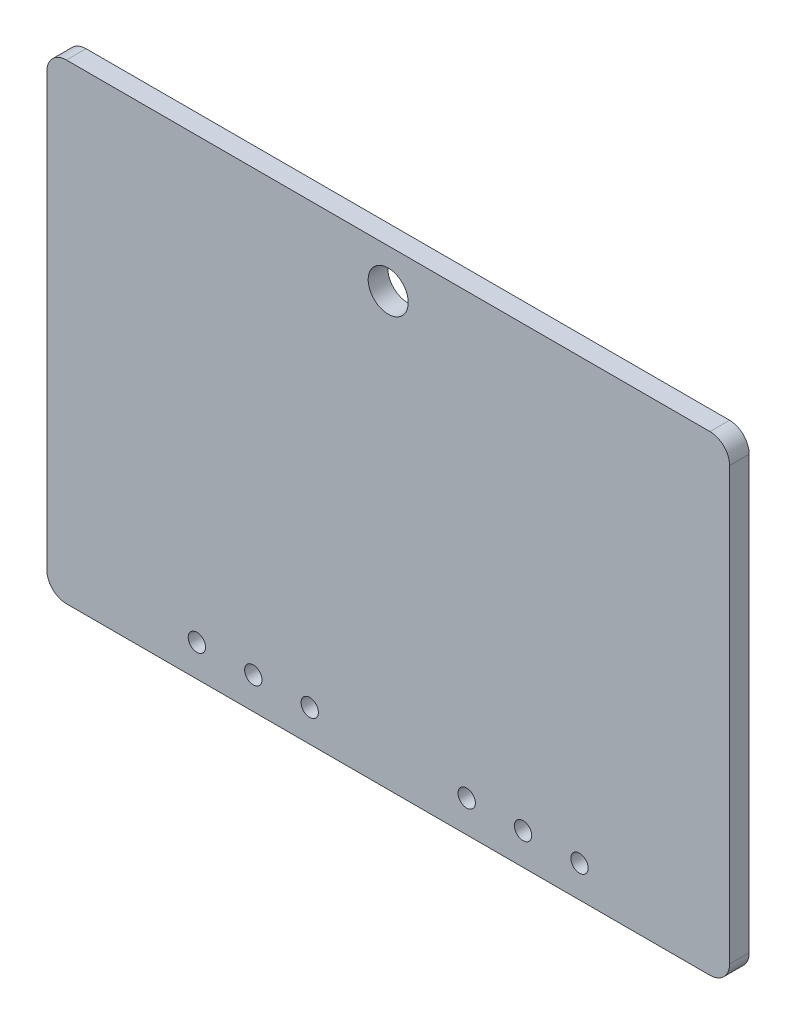
from build123d import *

# Parameters (mm, degrees)
SKETCH1_W              = 220.98
SKETCH1_H              = 152.4
BOSS_EXTRUDE1_DEPTH    = 6.35
F_10_CLEARANCE_HOLE1_D = 5.6134
SKETCH8_R              = 6.477
CUT_EXTRUDE1_DEPTH     = 269.511159731
FILLET1_R              = 6.35


with BuildPart() as part:
    # Sketch1 → Boss-Extrude1 (new body)
    with BuildSketch(Plane.XY):
        with Locations((110.49, 76.2)):
            Rectangle(SKETCH1_W, SKETCH1_H)
    extrude(amount=BOSS_EXTRUDE1_DEPTH)

    # #10 Clearance Hole1 (through all)
    with Locations(Plane.XY.offset(6.35)):
        with Locations((48.5775, 10.3124), (85.09, 10.3124), (135.89, 10.3124), (172.4025, 10.3124), (66.83375, 10.3124), (154.14625, 10.3124)):
            Hole(F_10_CLEARANCE_HOLE1_D / 2)

    # Sketch8 → Cut-Extrude1 (cut, through all)
    with BuildSketch(Plane.XY.offset(6.35)):
        with Locations((110.49, 139.7)):
            Circle(SKETCH8_R)
    extrude(amount=-CUT_EXTRUDE1_DEPTH, mode=Mode.SUBTRACT)

    # Fillet1
    fillet1_edges = [part.edges().sort_by_distance(p)[0] for p in [
        (220.98, 0, 3.175),
        (220.98, 152.4, 3.175),
        (0, 152.4, 3.175),
        (0, 0, 3.175),
    ]]
    fillet(fillet1_edges, radius=FILLET1_R)


solid = part.part
